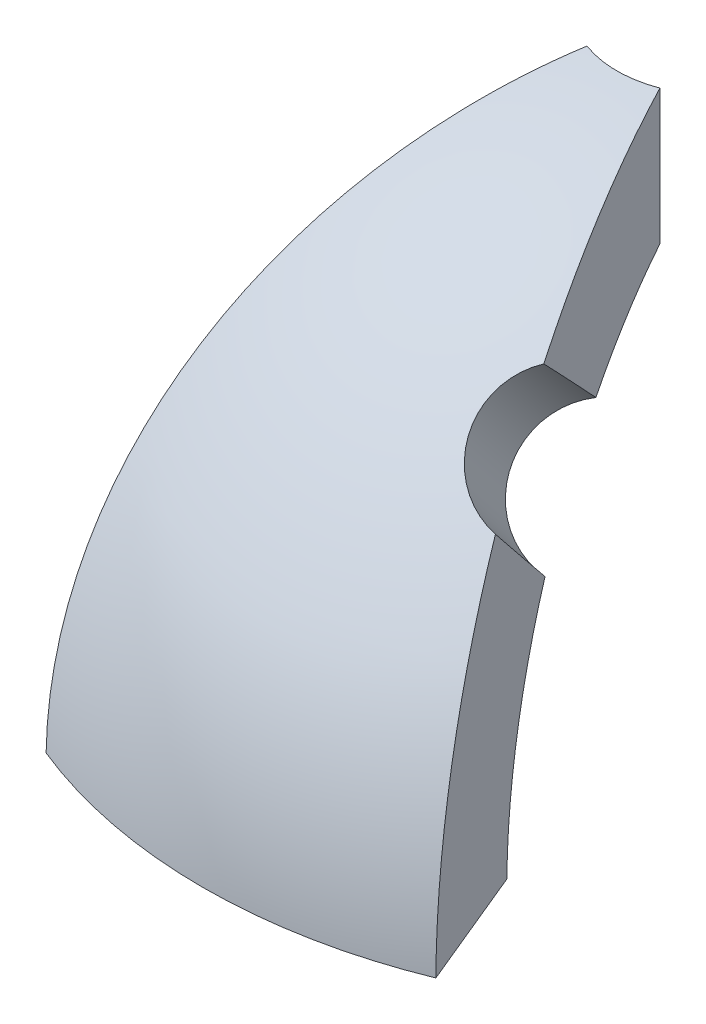
from build123d import *

# Parameters (mm, degrees)
REVOLVE1_ANGLE          = 45
CUT_EXTRUDE1_DEPTH      = 28.647117169
CUT_EXTRUDE1_DEPTH_BACK = 28.647117169
CUT_EXTRUDE4_START      = 13.576367639
CUT_EXTRUDE4_DEPTH      = 0.380999994
CUT_EXTRUDE4_START_2    = 13.957367633
CUT_EXTRUDE4_2_DEPTH    = 0.642564002
CUT_EXTRUDE5_DEPTH      = 28.732730484
CUT_EXTRUDE5_DEPTH_BACK = 28.732730484
SKETCH9_R               = 2.6035


with BuildPart() as part:
    # Sketch1 → Revolve1 (revolve, symmetric)
    with BuildSketch(Plane(origin=(0, 0, 0), x_dir=(0, 0, -1), z_dir=(1, 0, 0))) as revolve1_sk:
        with BuildLine():
            Line((-14.217802221, 0.25), (-19.048359509, 0.25))
            ThreePointArc((-19.048359509, 0.25), (-14.676690222, 12.144845166), (-3.81, 18.66511184))
            Line((-3.81, 18.66511184), (-3.81, 13.700083941))
            ThreePointArc((-3.81, 13.700083941), (-11.246181696, 8.70240181), (-14.217802221, 0.25))
        make_face()
    revolve(axis=Axis((0, 0, 0), (0, 1, 0)), revolution_arc=REVOLVE1_ANGLE / 2)
    revolve(revolve1_sk.sketch, axis=Axis((0, 0, 0), (0, -1, 0)), revolution_arc=REVOLVE1_ANGLE / 2)

    # Sketch2 → Cut-Extrude1 (cut, two sides: drawn at the far end of the back side and taken through both)
    with BuildSketch(Plane(origin=(0, 0, 0), x_dir=(1, 0, 0), z_dir=(0, 1, 0)).offset(-CUT_EXTRUDE1_DEPTH_BACK)):
        with BuildLine():
            Line((7.289491598, -17.598389479), (1.458023877, -3.519981019))
            ThreePointArc((1.458023877, -3.519981019), (1.400077392, -3.543428184), (1.341754023, -3.5659215))
            Line((1.341754023, -3.5659215), (7.173849701, -17.645845983))
            ThreePointArc((7.173849701, -17.645845983), (7.231709577, -17.622212591), (7.289491598, -17.598389479))
        make_face()
        with BuildLine():
            Line((-7.173849701, -17.645845983), (-1.341754023, -3.5659215))
            ThreePointArc((-1.341754023, -3.5659215), (-1.400077392, -3.543428184), (-1.458023877, -3.519981019))
            Line((-1.458023877, -3.519981019), (-7.289491598, -17.598389479))
            ThreePointArc((-7.289491598, -17.598389479), (-7.231709577, -17.622212591), (-7.173849701, -17.645845983))
        make_face()
    extrude(amount=CUT_EXTRUDE1_DEPTH + CUT_EXTRUDE1_DEPTH_BACK, mode=Mode.SUBTRACT)

    # Cut-Extrude4: read off the stored shape, not the designer's step
    # Cut-Extrude4 outline → Cut-Extrude4 (cut)
    with BuildSketch(Plane(origin=(0, 0, 0), x_dir=(-1, 0, 0), z_dir=(0, 0.3826834323650899, 0.9238795325112868)).offset(CUT_EXTRUDE4_START)):
        with BuildLine():
            add(Edge.make_bspline(
                [(-0.968782051, 0.862639779), (-0.953500776, 0.704297035), (-0.923044848, 0.542890698), (-0.855145508, 0.398864139), (-0.808724978, 0.30039795), (-0.745897012, 0.207923685), (-0.670245705, 0.129565817), (-0.594412641, 0.051019689), (-0.503545716, -0.015548318), (-0.405099082, -0.062878158), (-0.311601318, -0.107828748), (-0.209546118, -0.137449131), (-0.106757843, -0.151684794), (-0.05109477, -0.159393852), (0.005262189, -0.1617206), (0.061439303, -0.163129452)],
                knots=[0, 0, 0, 0, 0.29838771, 0.29838771, 0.29838771, 0.500936586, 0.500936586, 0.500936586, 0.704289141, 0.704289141, 0.704289141, 0.896734057, 0.896734057, 0.896734057, 1, 1, 1, 1], degree=3))
            Line((-0.968782051, 0.862639779), (-1.367692308, 0.862639779))
            add(Edge.make_bspline(
                [(0.081919071, -0.619026887), (-0.086162496, -0.61531723), (-0.257167265, -0.593217389), (-0.415863302, -0.537759882), (-0.576051263, -0.481781012), (-0.72706091, -0.391594396), (-0.854625463, -0.279801274), (-0.966467496, -0.181786819), (-1.065524634, -0.066561713), (-1.143726934, 0.059834888), (-1.232584949, 0.203454079), (-1.294864437, 0.365862515), (-1.329447249, 0.531081722), (-1.352245152, 0.639998589), (-1.362236386, 0.751562149), (-1.367692308, 0.862639779)],
                knots=[0, 0, 0, 0, 0.219321271, 0.219321271, 0.219321271, 0.441568871, 0.441568871, 0.441568871, 0.635043827, 0.635043827, 0.635043827, 0.85588519, 0.85588519, 0.85588519, 1, 1, 1, 1], degree=3))
            add(Edge.make_bspline(
                [(1.424679487, 0.702363337), (1.419981236, 0.545512864), (1.398709626, 0.385831481), (1.345210286, 0.238274474), (1.291294192, 0.089568013), (1.206545942, -0.050106462), (1.103378814, -0.170072469), (1.007347044, -0.281741256), (0.89204272, -0.380253902), (0.763987364, -0.453127945), (0.63762939, -0.525036038), (0.495452933, -0.572269115), (0.352111836, -0.596853545), (0.263052547, -0.612128103), (0.172266933, -0.616929095), (0.081919071, -0.619026887)],
                knots=[0, 0, 0, 0, 0.2250597, 0.2250597, 0.2250597, 0.452233869, 0.452233869, 0.452233869, 0.663328732, 0.663328732, 0.663328732, 0.871773853, 0.871773853, 0.871773853, 1, 1, 1, 1], degree=3))
            add(Edge.make_bspline(
                [(0.525350561, 2.297113938), (0.632201272, 2.182552925), (0.739042665, 2.067510357), (0.841026473, 1.948138788), (0.943081147, 1.828684271), (1.042867018, 1.706551704), (1.132291654, 1.577154573), (1.222325588, 1.446875791), (1.302241046, 1.306213708), (1.351938808, 1.155861709), (1.399991449, 1.01048674), (1.419363896, 0.85539296), (1.424679487, 0.702363337)],
                knots=[0, 0, 0, 0, 0.250309738, 0.250309738, 0.250309738, 0.500902382, 0.500902382, 0.500902382, 0.754675063, 0.754675063, 0.754675063, 1, 1, 1, 1], degree=3))
            Line((0.525350561, 2.297113938), (-0.586789864, 3.484050036))
            Line((-0.586789864, 3.484050036), (1.481666667, 3.484050036))
            Line((1.481666667, 3.484050036), (1.481666667, 3.939947472))
            Line((1.481666667, 3.939947472), (-1.538653846, 3.939947472))
            Line((-1.538653846, 3.939947472), (0.185208333, 2.100330084))
            add(Edge.make_bspline(
                [(1.025769231, 0.737980324), (1.015103197, 1.014455984), (0.898431748, 1.272392114), (0.563340129, 1.703651021), (0.374186439, 1.903082751), (0.185208333, 2.100330084)],
                knots=[0, 0, 0, 0, 0.5, 0.5, 1, 1, 1, 1], degree=3))
            add(Edge.make_bspline(
                [(0.061439303, -0.163129452), (0.181431455, -0.159946897), (0.303817751, -0.144655767), (0.416529018, -0.103477757), (0.530319754, -0.061905373), (0.636925683, 0.00439439), (0.726940524, 0.085370693), (0.806313998, 0.156774146), (0.876464564, 0.241486679), (0.926661814, 0.335660386), (0.975537276, 0.427354324), (1.007932207, 0.529885904), (1.019839954, 0.633102375), (1.023852868, 0.667886351), (1.024847174, 0.702980304), (1.025769231, 0.737980324)],
                knots=[0, 0, 0, 0, 0.246669413, 0.246669413, 0.246669413, 0.496293306, 0.496293306, 0.496293306, 0.715573497, 0.715573497, 0.715573497, 0.929171565, 0.929171565, 0.929171565, 1, 1, 1, 1], degree=3))
        make_face()
    extrude(amount=CUT_EXTRUDE4_DEPTH, mode=Mode.SUBTRACT)

    # Cut-Extrude4 2 outline → Cut-Extrude4 2 (cut)
    with BuildSketch(Plane(origin=(0, 0, 0), x_dir=(1, 0, 0), z_dir=(0, 0.38268343236508995, 0.9238795325112867)).offset(CUT_EXTRUDE4_START_2)):
        with BuildLine():
            add(Edge.make_bspline(
                [(0.968782051, -0.862639779), (0.953500776, -0.704297035), (0.923044848, -0.542890698), (0.855145508, -0.398864139), (0.808724978, -0.30039795), (0.745897012, -0.207923685), (0.670245705, -0.129565817), (0.594412641, -0.051019689), (0.503545716, 0.015548318), (0.405099082, 0.062878158), (0.311601318, 0.107828748), (0.209546118, 0.137449131), (0.106757843, 0.151684794), (0.05109477, 0.159393852), (-0.005262189, 0.1617206), (-0.061439303, 0.163129452)],
                knots=[0, 0, 0, 0, 0.29838771, 0.29838771, 0.29838771, 0.500936586, 0.500936586, 0.500936586, 0.704289141, 0.704289141, 0.704289141, 0.896734057, 0.896734057, 0.896734057, 1, 1, 1, 1], degree=3))
            Line((0.968782051, -0.862639779), (1.367692308, -0.862639779))
            add(Edge.make_bspline(
                [(-0.081919071, 0.619026887), (0.086162496, 0.61531723), (0.257167265, 0.593217389), (0.415863302, 0.537759882), (0.576051263, 0.481781012), (0.72706091, 0.391594396), (0.854625463, 0.279801274), (0.966467496, 0.181786819), (1.065524634, 0.066561713), (1.143726934, -0.059834888), (1.232584949, -0.203454079), (1.294864437, -0.365862515), (1.329447249, -0.531081722), (1.352245152, -0.639998589), (1.362236386, -0.751562149), (1.367692308, -0.862639779)],
                knots=[0, 0, 0, 0, 0.219321271, 0.219321271, 0.219321271, 0.441568871, 0.441568871, 0.441568871, 0.635043827, 0.635043827, 0.635043827, 0.85588519, 0.85588519, 0.85588519, 1, 1, 1, 1], degree=3))
            add(Edge.make_bspline(
                [(-1.424679487, -0.702363337), (-1.419981236, -0.545512864), (-1.398709626, -0.385831481), (-1.345210286, -0.238274474), (-1.291294192, -0.089568013), (-1.206545942, 0.050106462), (-1.103378814, 0.170072469), (-1.007347044, 0.281741256), (-0.89204272, 0.380253902), (-0.763987364, 0.453127945), (-0.63762939, 0.525036038), (-0.495452933, 0.572269115), (-0.352111836, 0.596853545), (-0.263052547, 0.612128103), (-0.172266933, 0.616929095), (-0.081919071, 0.619026887)],
                knots=[0, 0, 0, 0, 0.2250597, 0.2250597, 0.2250597, 0.452233869, 0.452233869, 0.452233869, 0.663328732, 0.663328732, 0.663328732, 0.871773853, 0.871773853, 0.871773853, 1, 1, 1, 1], degree=3))
            add(Edge.make_bspline(
                [(-0.525350561, -2.297113938), (-0.632201272, -2.182552925), (-0.739042665, -2.067510357), (-0.841026473, -1.948138788), (-0.943081147, -1.828684271), (-1.042867018, -1.706551704), (-1.132291654, -1.577154573), (-1.222325588, -1.446875791), (-1.302241046, -1.306213708), (-1.351938808, -1.155861709), (-1.399991449, -1.01048674), (-1.419363896, -0.85539296), (-1.424679487, -0.702363337)],
                knots=[0, 0, 0, 0, 0.250309738, 0.250309738, 0.250309738, 0.500902382, 0.500902382, 0.500902382, 0.754675063, 0.754675063, 0.754675063, 1, 1, 1, 1], degree=3))
            Line((-0.525350561, -2.297113938), (0.586789864, -3.484050036))
            Line((0.586789864, -3.484050036), (-1.481666667, -3.484050036))
            Line((-1.481666667, -3.484050036), (-1.481666667, -3.939947472))
            Line((-1.481666667, -3.939947472), (1.538653846, -3.939947472))
            Line((1.538653846, -3.939947472), (-0.185208333, -2.100330084))
            add(Edge.make_bspline(
                [(-1.025769231, -0.737980324), (-1.015103197, -1.014455984), (-0.898431748, -1.272392114), (-0.563340129, -1.703651021), (-0.374186439, -1.903082751), (-0.185208333, -2.100330084)],
                knots=[0, 0, 0, 0, 0.5, 0.5, 1, 1, 1, 1], degree=3))
            add(Edge.make_bspline(
                [(-0.061439303, 0.163129452), (-0.181431455, 0.159946897), (-0.303817751, 0.144655767), (-0.416529018, 0.103477757), (-0.530319754, 0.061905373), (-0.636925683, -0.00439439), (-0.726940524, -0.085370693), (-0.806313998, -0.156774146), (-0.876464564, -0.241486679), (-0.926661814, -0.335660386), (-0.975537276, -0.427354324), (-1.007932207, -0.529885904), (-1.019839954, -0.633102375), (-1.023852868, -0.667886351), (-1.024847174, -0.702980304), (-1.025769231, -0.737980324)],
                knots=[0, 0, 0, 0, 0.246669413, 0.246669413, 0.246669413, 0.496293306, 0.496293306, 0.496293306, 0.715573497, 0.715573497, 0.715573497, 0.929171565, 0.929171565, 0.929171565, 1, 1, 1, 1], degree=3))
        make_face()
    extrude(amount=CUT_EXTRUDE4_2_DEPTH, mode=Mode.SUBTRACT)

    # Cut-Extrude4 3 outline → Cut-Extrude4 3 (revolve)
    with BuildSketch(Plane(origin=(0, 0, 0), x_dir=(1, 0, 0), z_dir=(0, -0.9238795325112867, 0.38268343236508995))):
        with BuildLine():
            ThreePointArc((0.174307658, 14.599931635), (2.22533499, 14.425795626), (4.229733075, 13.957367633))
            Line((4.229733075, 13.957367633), (4.229733075, 14.599931635))
            Line((4.229733075, 14.599931635), (0.174307658, 14.599931635))
        make_face()
    revolve(axis=Axis((0, 0, 0), (0, 0.38268343236508995, 0.9238795325112867)))

    # Sketch9 → Cut-Extrude5 (cut, two sides: drawn at the far end of the back side and taken through both)
    with BuildSketch(Plane(origin=(8.561597025, 18.858537854, 16.803080265), x_dir=(0.9470724962077209, -0.23968096505674558, -0.2135573035893259), z_dir=(0.32101976096009477, 0.7071067811865476, 0.6300367553350547)).offset(-CUT_EXTRUDE5_DEPTH_BACK)):
        Circle(SKETCH9_R)
    extrude(amount=CUT_EXTRUDE5_DEPTH + CUT_EXTRUDE5_DEPTH_BACK, mode=Mode.SUBTRACT)


solid = part.part
